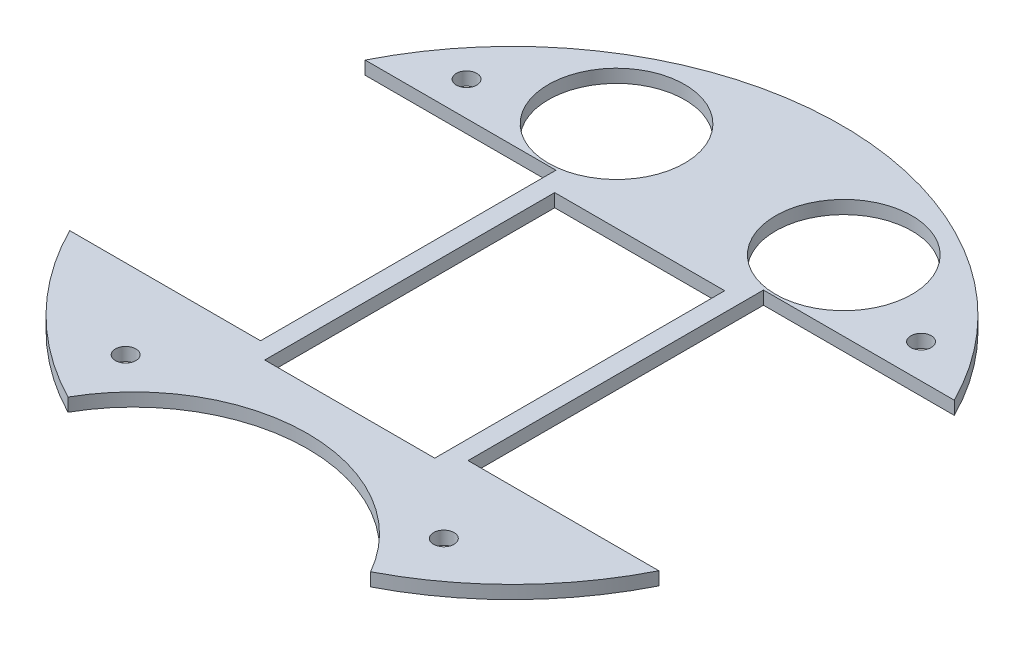
from build123d import *

# Parameters (mm, degrees)
BOSS_EXTRUDE1_DEPTH  = 2.9
SOLENOID_PLACEMENT_W = 37.4
SOLENOID_PLACEMENT_H = 63.8
CUT_EXTRUDE1_DEPTH   = 103.571487266
CUT_EXTRUDE3_DEPTH   = 103.571487266
SKETCH7_R            = 15
CUT_EXTRUDE6_DEPTH   = 98.286484159
SKETCH8_R            = 2.25
CUT_EXTRUDE7_DEPTH   = 98.286484159


with BuildPart() as part:
    # Sketch1 → Boss-Extrude1 (new body)
    with BuildSketch(Plane(origin=(0, 0, 0), x_dir=(1, 0, 0), z_dir=(0, 1, 0))):
        with BuildLine():
            ThreePointArc((33.29110537, -64.404598464), (0, 72.5), (-33.29110537, -64.404598464))
            ThreePointArc((-33.29110537, -64.404598464), (0, -44.989799638), (33.29110537, -64.404598464))
        make_face()
    extrude(amount=BOSS_EXTRUDE1_DEPTH)

    # solenoid placement → Cut-Extrude1 (cut, through all)
    with BuildSketch(Plane(origin=(0, 2.9, 0), x_dir=(1, 0, 0), z_dir=(0, 1, 0))):
        with Locations((0, -3.8)):
            Rectangle(SOLENOID_PLACEMENT_W, SOLENOID_PLACEMENT_H)
    extrude(amount=-CUT_EXTRUDE1_DEPTH, mode=Mode.SUBTRACT)

    # Sketch3 → Cut-Extrude3 (cut, through all)
    with BuildSketch(Plane(origin=(0, 2.9, 0), x_dir=(1, 0, 0), z_dir=(0, 1, 0))):
        with BuildLine():
            Line((-34.63, -32.5), (-22.83, -32.5))
            Line((-22.83, -32.5), (-22.83, 32.5))
            Line((-22.83, 32.5), (-64.807406984, 32.5))
            ThreePointArc((-64.807406984, 32.5), (-72.5, 0), (-64.807406984, -32.5))
            Line((-64.807406984, -32.5), (-34.63, -32.5))
        make_face()
        with BuildLine():
            Line((22.83, -32.5), (22.83, 32.5))
            Line((22.83, 32.5), (64.807406984, 32.5))
            ThreePointArc((64.807406984, 32.5), (72.5, 0), (64.807406984, -32.5))
            Line((64.807406984, -32.5), (34.63, -32.5))
            Line((34.63, -32.5), (22.83, -32.5))
        make_face()
    extrude(amount=-CUT_EXTRUDE3_DEPTH, mode=Mode.SUBTRACT)

    # Sketch7 → Cut-Extrude6 (cut, through all)
    with BuildSketch(Plane(origin=(0, 2.9, 0), x_dir=(1, 0, 0), z_dir=(0, 1, 0))):
        with Locations((25, 48)):
            Circle(SKETCH7_R)
        with Locations((-25, 48)):
            Circle(SKETCH7_R)
    extrude(amount=-CUT_EXTRUDE6_DEPTH, mode=Mode.SUBTRACT)

    # Sketch8 → Cut-Extrude7 (cut, through all)
    with BuildSketch(Plane(origin=(0, 2.9, 0), x_dir=(1, 0, 0), z_dir=(0, 1, 0))):
        with Locations((35, -50)):
            Circle(SKETCH8_R)
        with Locations((-35, -50)):
            Circle(SKETCH8_R)
        with Locations((-50, 40)):
            Circle(SKETCH8_R)
        with Locations((50, 40)):
            Circle(SKETCH8_R)
    extrude(amount=-CUT_EXTRUDE7_DEPTH, mode=Mode.SUBTRACT)


solid = part.part
